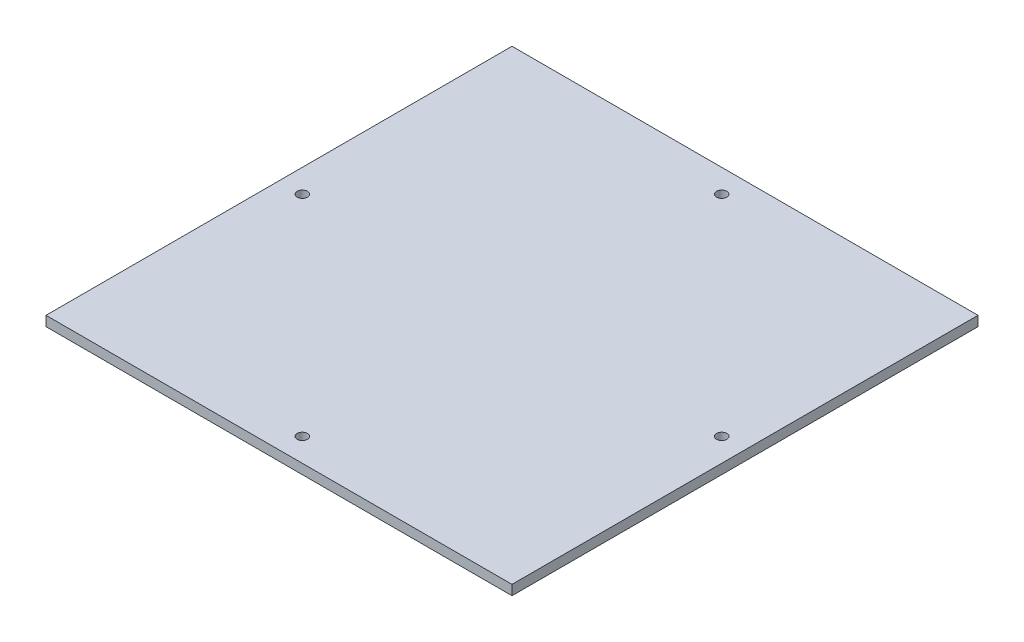
from build123d import *

# Parameters (mm, degrees)
SKETCH1_W           = 150
SKETCH1_H           = 150
SKETCH1_R           = 1.65
BOSS_EXTRUDE1_DEPTH = 3.175


with BuildPart() as part:
    # Sketch1 → Boss-Extrude1 (new body)
    with BuildSketch(Plane(origin=(0, 0, 0), x_dir=(1, 0, 0), z_dir=(0, 1, 0))):
        Rectangle(SKETCH1_W, SKETCH1_H)
        with Locations((-67.5, 0)):
            Circle(SKETCH1_R, mode=Mode.SUBTRACT)
        with Locations((0, 67.5)):
            Circle(SKETCH1_R, mode=Mode.SUBTRACT)
        with Locations((67.5, 0)):
            Circle(SKETCH1_R, mode=Mode.SUBTRACT)
        with Locations((0, -67.5)):
            Circle(SKETCH1_R, mode=Mode.SUBTRACT)
    extrude(amount=BOSS_EXTRUDE1_DEPTH)


solid = part.part
